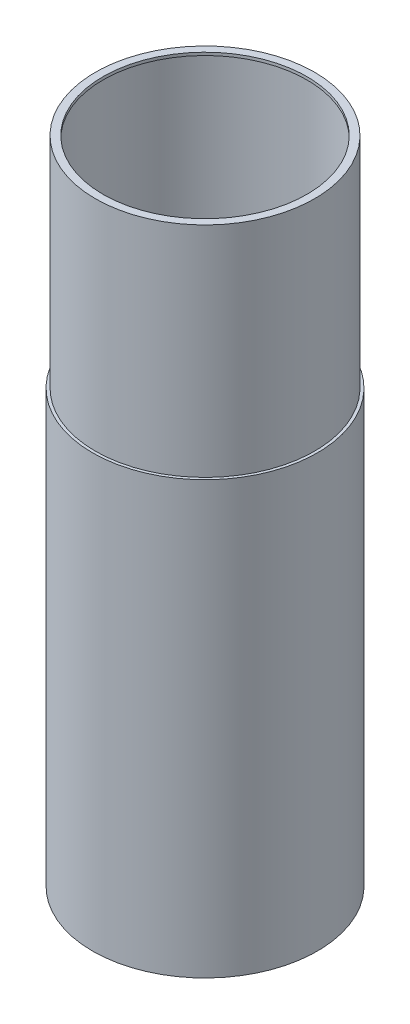
from build123d import *

# Parameters (mm, degrees)
SKETCH1_W                = 1.96
SKETCH1_H                = 300
BOSS_EXTRUDE1_DEPTH      = 152
BOSS_EXTRUDE1_DEPTH_BACK = 152
SKETCH3_R                = 76.2
SKETCH3_R_2              = 75.2
BOSS_EXTRUDE2_START      = -2
SKETCH4_R                = 76.2
SKETCH4_R_2              = 70.915017824
BOSS_EXTRUDE2_DEPTH      = 2


with BuildPart() as part:
    # Sketch1 → Revolve1 (revolve)
    with BuildSketch(Plane.XY):
        with Locations((77.18, 150)):
            Rectangle(SKETCH1_W, SKETCH1_H)
    revolve(axis=Axis((0, 204.615384615, 0), (0, -1, 0)))

    # Sketch3 → Boss-Extrude1 (add, two sides: drawn at the far end of the back side and taken through both)
    with BuildSketch(Plane(origin=(0, 300, 0), x_dir=(1, 0, 0), z_dir=(0, 1, 0)).offset(-BOSS_EXTRUDE1_DEPTH_BACK)):
        Circle(SKETCH3_R)
        Circle(SKETCH3_R_2, mode=Mode.SUBTRACT)
    extrude(amount=BOSS_EXTRUDE1_DEPTH + BOSS_EXTRUDE1_DEPTH_BACK)

    # Sketch4 → Boss-Extrude2 (add)
    with BuildSketch(Plane(origin=(0, 452, 0), x_dir=(1, 0, 0), z_dir=(0, 1, 0)).offset(BOSS_EXTRUDE2_START)):
        Circle(SKETCH4_R)
        Circle(SKETCH4_R_2, mode=Mode.SUBTRACT)
    extrude(amount=BOSS_EXTRUDE2_DEPTH)


solid = part.part
